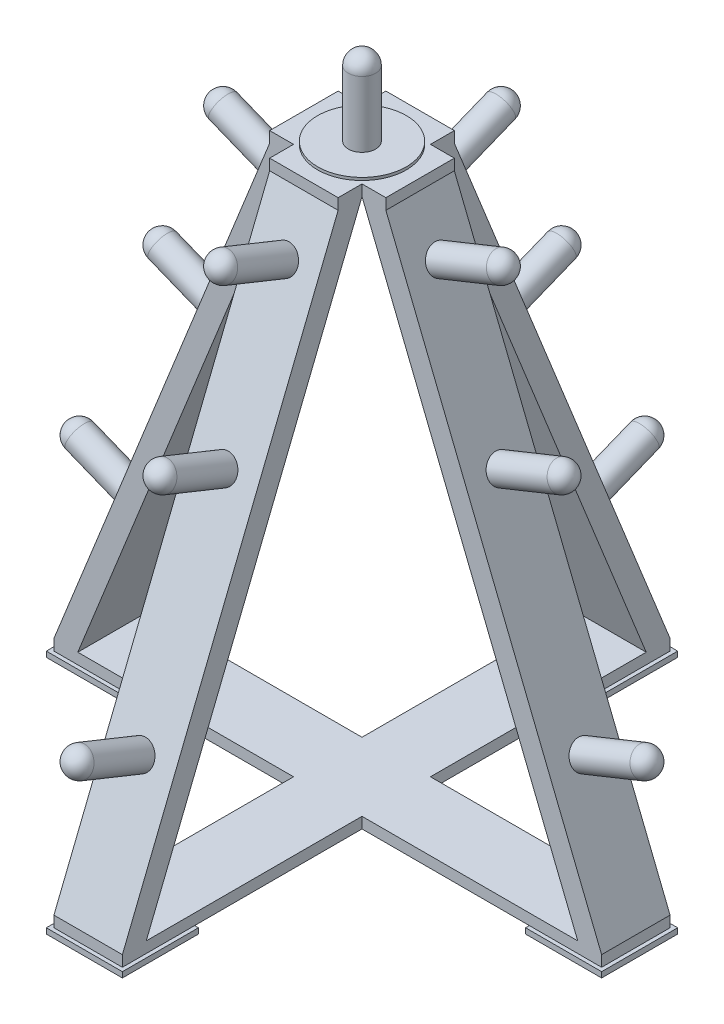
from build123d import *
from build123d.topology import SkipClean

# Parameters (mm, degrees)
BOSS_EXTRUDE1_DEPTH     = 20
BOSS_EXTRUDE2_DEPTH     = 20
SKETCH4_W               = 43.587031298
SKETCH4_H               = 125
MIRROR3_COPY_1_SKETCH_W = 43.587031298
MIRROR3_COPY_1_SKETCH_H = 125
MIRROR3_COPY_2_SKETCH_W = 43.587031298
MIRROR3_COPY_2_SKETCH_H = 125
SKETCH8_R               = 25
BOSS_EXTRUDE3_DEPTH     = 120
SKETCH11_W              = 138.854230546
SKETCH11_H              = 138.854230546
BOSS_EXTRUDE4_DEPTH     = 10
SKETCH12_R              = 81
BOSS_EXTRUDE5_DEPTH     = 5
SKETCH13_R              = 25
BOSS_EXTRUDE6_DEPTH     = 120
MIRROR6_COPY_1_SKETCH_R = 25
MIRROR6_COPY_1_DEPTH    = 120
MIRROR6_COPY_4_SKETCH_W = 138.854230546
MIRROR6_COPY_4_SKETCH_H = 138.854230546
MIRROR6_COPY_4_DEPTH    = 10
MIRROR6_COPY_6_SKETCH_R = 25
MIRROR6_COPY_6_DEPTH    = 120
MIRROR6_COPY_9_SKETCH_W = 138.854230546
MIRROR6_COPY_9_SKETCH_H = 138.854230546
MIRROR6_COPY_9_DEPTH    = 10


with BuildPart() as part:
    # Sketch1 → Boss-Extrude1 (new body)
    with BuildSketch(Plane(origin=(0, 0, 0), x_dir=(1, 0, 0), z_dir=(0, 1, 0))):
        Polygon((500, 62.5), (62.5, 62.5), (62.5, 500), (-62.5, 500), (-62.5, 62.5), (-500, 62.5), (-500, -62.5), (-62.5, -62.5), (-62.5, -500), (62.5, -500), (62.5, -62.5), (500, -62.5), align=None)
    extrude(amount=BOSS_EXTRUDE1_DEPTH)



with BuildPart() as body_2:
    # Sketch2 → Boss-Extrude2 (new body)
    with BuildSketch(Plane(origin=(0, 1000, 0), x_dir=(1, 0, 0), z_dir=(0, 1, 0))):
        Polygon((-62.5, 106.087031298), (-62.5, 62.5), (-106.087031298, 62.5), (-106.087031298, -62.5), (-62.5, -62.5), (-62.5, -106.087031298), (62.5, -106.087031298), (62.5, -62.5), (106.087031298, -62.5), (106.087031298, 62.5), (62.5, 62.5), (62.5, 106.087031298), align=None)
    extrude(amount=BOSS_EXTRUDE2_DEPTH)


with BuildPart() as part_1:
    add(part.part)

    add(body_2.part)  # Sweep1 merges body 2
    # Sweep1: sweep along a path in Sketch5
    with BuildLine(Plane.XY) as sweep1_path:
        Line((-478.206484351, 20), (-84.293515649, 1000))
    # Sketch4 → Sweep1 (sweep)
    with BuildSketch(Plane(origin=(0, 1000, 0), x_dir=(1, 0, 0), z_dir=(0, 1, 0))):
        with Locations((-84.293515649, 0)):
            Rectangle(SKETCH4_W, SKETCH4_H)
    sweep1 = sweep(path=sweep1_path.line)

    # Mirror1: Sweep1 across plane
    add(sweep1.mirror(Plane(origin=(0, 0, 0), x_dir=(0, 0, 1), z_dir=(1, 0, 0))))

    # Mirror2: Sweep1 across plane
    add(sweep1.mirror(Plane(origin=(0, 0, 0), x_dir=(-0.7071067811865477, 0, 0.7071067811865474), z_dir=(-0.7071067811865476, 0, -0.7071067811865476))))

    # Mirror3 copy 1: sweep along a path in Mirror3 copy 1 path
    with BuildLine(Plane.ZY) as mirror3_copy_1_path:
        Line((-478.206484351, 20), (-84.293515649, 1000))
    # Mirror3 copy 1 sketch → Mirror3 copy 1 (sweep)
    with BuildSketch(Plane.ZX.offset(1000)):
        with Locations((-84.293515649, 0)):
            Rectangle(MIRROR3_COPY_1_SKETCH_W, MIRROR3_COPY_1_SKETCH_H)
    sweep(path=mirror3_copy_1_path.line)

    # Mirror3 copy 2: sweep along a path in Mirror3 copy 2 path
    with BuildLine(Plane(origin=(0, 0, 0), x_dir=(1, 0, 0), z_dir=(0, 0, -1))) as mirror3_copy_2_path:
        Line((-478.206484351, -20), (-84.293515649, -1000))
    # Mirror3 copy 2 sketch → Mirror3 copy 2 (sweep)
    with BuildSketch(Plane(origin=(0, 1000, 0), x_dir=(1, 0, 0), z_dir=(0, 1, 0))):
        with Locations((-84.293515649, 0)):
            Rectangle(MIRROR3_COPY_2_SKETCH_W, MIRROR3_COPY_2_SKETCH_H)
    sweep(path=mirror3_copy_2_path.line)

    # Sketch8 → Boss-Extrude3 (add)
    with BuildSketch(Plane(origin=(0, 175.803540397, 437.374453947), x_dir=(1, 0, 0), z_dir=(0, 0.3729515073235979, 0.9278508356331078))):
        with Locations((0, 493.552067167)):
            Circle(SKETCH8_R)
        with Locations((0, 87.718964011)):
            Circle(SKETCH8_R)
        with Locations((0, 790.631360439)):
            Circle(SKETCH8_R)
    boss_extrude3 = extrude(amount=BOSS_EXTRUDE3_DEPTH)

    # Sketch9 → Revolve1 (revolve)
    with BuildSketch(Plane(origin=(0, 220.557721276, 548.716554223), x_dir=(1, 0, 0), z_dir=(0, 0.372951507323598, 0.9278508356331078))):
        with BuildLine():
            Line((-25, 493.552067167), (25, 493.552067167))
            ThreePointArc((25, 493.552067167), (0, 518.552067167), (-25, 493.552067167))
        make_face()
    revolve1 = revolve(axis=Axis((-25, 678.500419225, 364.64556683), (1, 0, 0)))

    # Sketch10 → Revolve2 (revolve)
    with BuildSketch(Plane(origin=(0, 220.557721276, 548.716554223), x_dir=(1, 0, 0), z_dir=(0, 0.372951507323598, 0.9278508356331078))):
        with BuildLine():
            Line((-25, 87.718964011), (25, 87.718964011))
            ThreePointArc((25, 87.718964011), (0, 112.718964011), (-25, 87.718964011))
        make_face()
    revolve2 = revolve(axis=Axis((-25, 301.947835334, 516.001634374), (1, 0, 0)))

    # Sketch11 → Boss-Extrude4 (add)
    with BuildSketch(Plane.XZ):
        with Locations((0, 437.5)):
            Rectangle(SKETCH11_W, SKETCH11_H)
    boss_extrude4 = extrude(amount=BOSS_EXTRUDE4_DEPTH)

    # Sketch12 → Boss-Extrude5 (add)
    with BuildSketch(Plane(origin=(0, 1020, 0), x_dir=(1, 0, 0), z_dir=(0, 1, 0))):
        Circle(SKETCH12_R)
    extrude(amount=BOSS_EXTRUDE5_DEPTH)

    # Sketch13 → Boss-Extrude6 (add)
    with BuildSketch(Plane(origin=(0, 1025, 0), x_dir=(1, 0, 0), z_dir=(0, 1, 0))):
        Circle(SKETCH13_R)
    extrude(amount=BOSS_EXTRUDE6_DEPTH)

    # Sketch14 → Revolve3 (revolve)
    with SkipClean():  # the faces are left unmerged after this step: merging them gives an invalid solid
        with BuildSketch(Plane(origin=(0, 1145, 0), x_dir=(1, 0, 0), z_dir=(0, 1, 0))):
            with BuildLine():
                Line((-25, 0), (25, 0))
                ThreePointArc((25, 0), (0, 25), (-25, 0))
            make_face()
        revolve(axis=Axis((-25, 1145, 0), (1, 0, 0)))
    add(part_1.part.scale(1), mode=Mode.REPLACE)  # the faces are merged on a copy

    # Sketch15 → Revolve4 (revolve)
    with BuildSketch(Plane(origin=(0, 220.557721276, 548.716554223), x_dir=(1, 0, 0), z_dir=(0, 0.3729515073235979, 0.9278508356331077))):
        with BuildLine():
            Line((-25, 790.631360439), (25, 790.631360439))
            ThreePointArc((25, 790.631360439), (0, 815.631360439), (-25, 790.631360439))
        make_face()
    revolve4 = revolve(axis=Axis((-25, 954.145689736, 253.84939661), (1, 0, 0)))

    # Mirror4: Boss-Extrude3, Revolve1, Revolve2, Boss-Extrude4, Revolve4 across plane
    add(boss_extrude3.mirror(Plane.XY))
    add(revolve1.mirror(Plane.XY))
    add(revolve2.mirror(Plane.XY))
    add(boss_extrude4.mirror(Plane.XY))
    add(revolve4.mirror(Plane.XY))

    # Mirror5: Boss-Extrude3, Revolve1, Revolve2, Boss-Extrude4, Revolve4 across plane
    add(boss_extrude3.mirror(Plane(origin=(0, 0, 0), x_dir=(-0.7071067811865477, 0, 0.7071067811865474), z_dir=(-0.7071067811865476, 0, -0.7071067811865476))))
    add(revolve1.mirror(Plane(origin=(0, 0, 0), x_dir=(-0.7071067811865477, 0, 0.7071067811865474), z_dir=(-0.7071067811865476, 0, -0.7071067811865476))))
    add(revolve2.mirror(Plane(origin=(0, 0, 0), x_dir=(-0.7071067811865477, 0, 0.7071067811865474), z_dir=(-0.7071067811865476, 0, -0.7071067811865476))))
    add(boss_extrude4.mirror(Plane(origin=(0, 0, 0), x_dir=(-0.7071067811865477, 0, 0.7071067811865474), z_dir=(-0.7071067811865476, 0, -0.7071067811865476))))
    add(revolve4.mirror(Plane(origin=(0, 0, 0), x_dir=(-0.7071067811865477, 0, 0.7071067811865474), z_dir=(-0.7071067811865476, 0, -0.7071067811865476))))

    # Mirror6 copy 1 sketch → Mirror6 copy 1 (add)
    with BuildSketch(Plane(origin=(437.374453947, 175.803540397, 0), x_dir=(0, 0, -1), z_dir=(0.927850835633108, 0.3729515073235979, 0))):
        with Locations((0, 493.552067167)):
            Circle(MIRROR6_COPY_1_SKETCH_R)
        with Locations((0, 87.718964011)):
            Circle(MIRROR6_COPY_1_SKETCH_R)
        with Locations((0, 790.631360439)):
            Circle(MIRROR6_COPY_1_SKETCH_R)
    extrude(amount=MIRROR6_COPY_1_DEPTH)

    # Mirror6 copy 2 sketch → Mirror6 copy 2 (revolve)
    with BuildSketch(Plane(origin=(548.716554223, 220.557721276, 0), x_dir=(0, 0, -1), z_dir=(0.927850835633108, 0.372951507323598, 0))):
        with BuildLine():
            Line((-25, 493.552067167), (25, 493.552067167))
            ThreePointArc((25, 493.552067167), (0, 518.552067167), (-25, 493.552067167))
        make_face()
    revolve(axis=Axis((364.64556683, 678.500419225, 25), (0, 0, -1)))

    # Mirror6 copy 3 sketch → Mirror6 copy 3 (revolve)
    with BuildSketch(Plane(origin=(548.716554223, 220.557721276, 0), x_dir=(0, 0, -1), z_dir=(0.927850835633108, 0.372951507323598, 0))):
        with BuildLine():
            Line((-25, 87.718964011), (25, 87.718964011))
            ThreePointArc((25, 87.718964011), (0, 112.718964011), (-25, 87.718964011))
        make_face()
    revolve(axis=Axis((516.001634374, 301.947835334, 25), (0, 0, -1)))

    # Mirror6 copy 4 sketch → Mirror6 copy 4 (add)
    with BuildSketch(Plane(origin=(0, 0, 0), x_dir=(0, 0, -1), z_dir=(0, -1, 0))):
        with Locations((0, 437.5)):
            Rectangle(MIRROR6_COPY_4_SKETCH_W, MIRROR6_COPY_4_SKETCH_H)
    extrude(amount=MIRROR6_COPY_4_DEPTH)

    # Mirror6 copy 5 sketch → Mirror6 copy 5 (revolve)
    with BuildSketch(Plane(origin=(548.716554223, 220.557721276, 0), x_dir=(0, 0, -1), z_dir=(0.9278508356331079, 0.3729515073235979, 0))):
        with BuildLine():
            Line((-25, 790.631360439), (25, 790.631360439))
            ThreePointArc((25, 790.631360439), (0, 815.631360439), (-25, 790.631360439))
        make_face()
    revolve(axis=Axis((253.84939661, 954.145689736, 25), (0, 0, -1)))

    # Mirror6 copy 6 sketch → Mirror6 copy 6 (add)
    with BuildSketch(Plane(origin=(0, 175.803540397, 437.374453947), x_dir=(-1, 0, 0), z_dir=(0, 0.3729515073235979, 0.9278508356331078))):
        with Locations((0, -493.552067167)):
            Circle(MIRROR6_COPY_6_SKETCH_R)
        with Locations((0, -87.718964011)):
            Circle(MIRROR6_COPY_6_SKETCH_R)
        with Locations((0, -790.631360439)):
            Circle(MIRROR6_COPY_6_SKETCH_R)
    extrude(amount=MIRROR6_COPY_6_DEPTH)

    # Mirror6 copy 7 sketch → Mirror6 copy 7 (revolve)
    with BuildSketch(Plane(origin=(0, 220.557721276, 548.716554223), x_dir=(-1, 0, 0), z_dir=(0, 0.372951507323598, 0.9278508356331078))):
        with BuildLine():
            Line((-25, -493.552067167), (25, -493.552067167))
            ThreePointArc((25, -493.552067167), (0, -518.552067167), (-25, -493.552067167))
        make_face()
    revolve(axis=Axis((25, 678.500419225, 364.64556683), (1, 0, 0)))

    # Mirror6 copy 8 sketch → Mirror6 copy 8 (revolve)
    with BuildSketch(Plane(origin=(0, 220.557721276, 548.716554223), x_dir=(-1, 0, 0), z_dir=(0, 0.372951507323598, 0.9278508356331078))):
        with BuildLine():
            Line((-25, -87.718964011), (25, -87.718964011))
            ThreePointArc((25, -87.718964011), (0, -112.718964011), (-25, -87.718964011))
        make_face()
    revolve(axis=Axis((25, 301.947835334, 516.001634374), (1, 0, 0)))

    # Mirror6 copy 9 sketch → Mirror6 copy 9 (add)
    with BuildSketch(Plane(origin=(0, 0, 0), x_dir=(-1, 0, 0), z_dir=(0, -1, 0))):
        with Locations((0, -437.5)):
            Rectangle(MIRROR6_COPY_9_SKETCH_W, MIRROR6_COPY_9_SKETCH_H)
    extrude(amount=MIRROR6_COPY_9_DEPTH)

    # Mirror6 copy 10 sketch → Mirror6 copy 10 (revolve)
    with BuildSketch(Plane(origin=(0, 220.557721276, 548.716554223), x_dir=(-1, 0, 0), z_dir=(0, 0.3729515073235979, 0.9278508356331077))):
        with BuildLine():
            Line((-25, -790.631360439), (25, -790.631360439))
            ThreePointArc((25, -790.631360439), (0, -815.631360439), (-25, -790.631360439))
        make_face()
    revolve(axis=Axis((25, 954.145689736, 253.84939661), (1, 0, 0)))


solid = part_1.part
